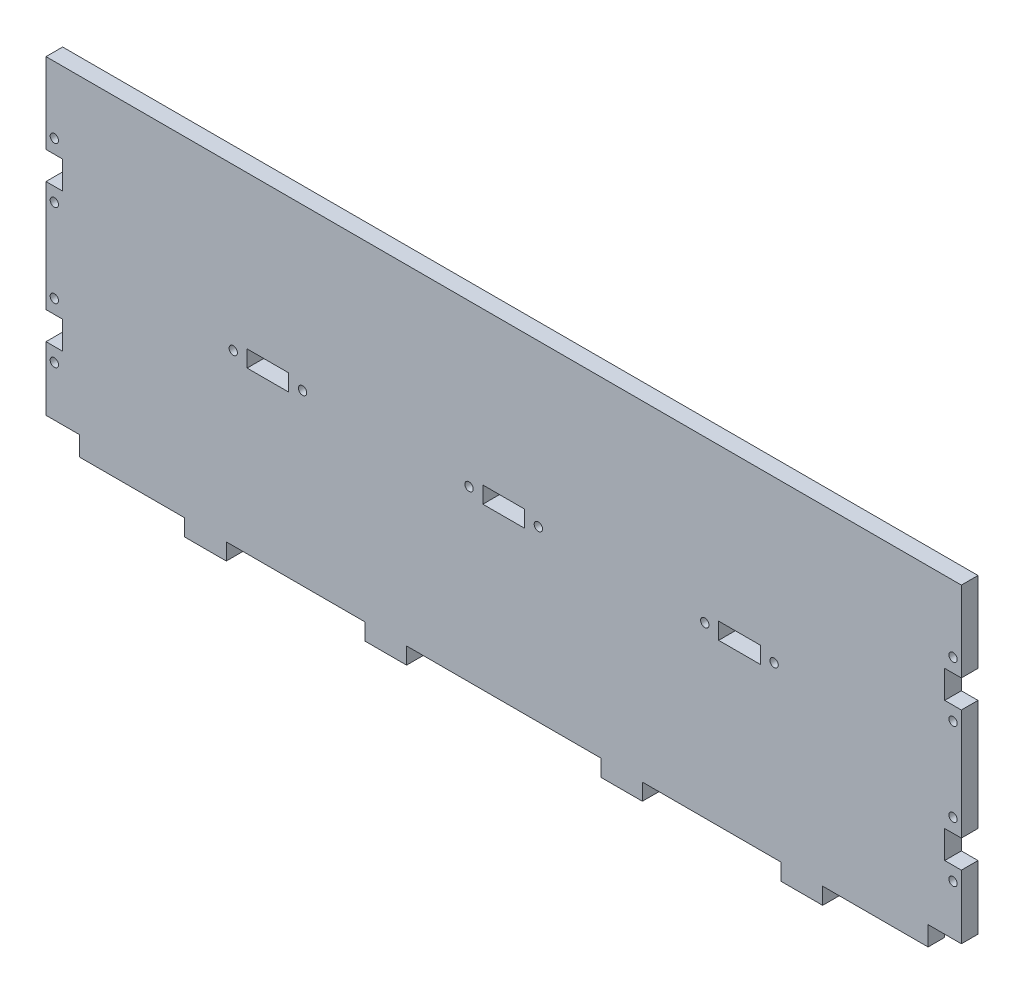
from build123d import *

# Parameters (mm, degrees)
ESQUISSE1_W             = 330
ESQUISSE1_H             = 238
ESQUISSE1_W_2           = 15
ESQUISSE1_H_2           = 6
BOSS_EXTRU_1_DEPTH      = 6
ESQUISSE2_W             = 15
ESQUISSE2_H             = 6
BOSS_EXTRU_2_DEPTH      = 6
ESQUISSE3_W             = 6
ESQUISSE3_H             = 10
ESQUISSE3_W_2           = 12
ESQUISSE3_H_2           = 7
ENL_V_MAT_EXTRU_1_DEPTH = 6
ESQUISSE4_R             = 1.5
ENL_V_MAT_EXTRU_2_DEPTH = 6
ESQUISSE5_W             = 356.185915781
ESQUISSE5_H             = 137.143349898
ENL_V_MAT_EXTRU_3_DEPTH = 6


with BuildPart() as part:
    # Esquisse1 → Boss.-Extru.1 (new body)
    with BuildSketch(Plane.XY):
        Rectangle(ESQUISSE1_W, ESQUISSE1_H)
        with Locations((-85, -58)):
            Rectangle(ESQUISSE1_W_2, ESQUISSE1_H_2, mode=Mode.SUBTRACT)
        with Locations((0, -58)):
            Rectangle(ESQUISSE1_W_2, ESQUISSE1_H_2, mode=Mode.SUBTRACT)
        with Locations((85, -58)):
            Rectangle(ESQUISSE1_W_2, ESQUISSE1_H_2, mode=Mode.SUBTRACT)
    extrude(amount=BOSS_EXTRU_1_DEPTH)

    # Esquisse2 → Boss.-Extru.2 (add)
    with BuildSketch(Plane.XY.offset(6)):
        with Locations((-107.5, 122)):
            Rectangle(ESQUISSE2_W, ESQUISSE2_H)
        with Locations((107.5, 122)):
            Rectangle(ESQUISSE2_W, ESQUISSE2_H)
        with Locations((42.5, 122)):
            Rectangle(ESQUISSE2_W, ESQUISSE2_H)
        with Locations((-42.5, 122)):
            Rectangle(ESQUISSE2_W, ESQUISSE2_H)
        with Locations((107.5, -122)):
            Rectangle(ESQUISSE2_W, ESQUISSE2_H)
        with Locations((-107.5, -122)):
            Rectangle(ESQUISSE2_W, ESQUISSE2_H)
        with Locations((-42.5, -122)):
            Rectangle(ESQUISSE2_W, ESQUISSE2_H)
        with Locations((42.5, -122)):
            Rectangle(ESQUISSE2_W, ESQUISSE2_H)
    extrude(amount=-BOSS_EXTRU_2_DEPTH)

    # Esquisse3 → Enlèv. mat.-Extru.1 (cut)
    with BuildSketch(Plane.XY.offset(6)):
        with Locations((-162, 84)):
            Rectangle(ESQUISSE3_W, ESQUISSE3_H)
        with Locations((-162, 34)):
            Rectangle(ESQUISSE3_W, ESQUISSE3_H)
        with Locations((-162, -34)):
            Rectangle(ESQUISSE3_W, ESQUISSE3_H)
        with Locations((-162, -84)):
            Rectangle(ESQUISSE3_W, ESQUISSE3_H)
        with Locations((162, -84)):
            Rectangle(ESQUISSE3_W, ESQUISSE3_H)
        with Locations((162, -34)):
            Rectangle(ESQUISSE3_W, ESQUISSE3_H)
        with Locations((162, 34)):
            Rectangle(ESQUISSE3_W, ESQUISSE3_H)
        with Locations((162, 84)):
            Rectangle(ESQUISSE3_W, ESQUISSE3_H)
        with Locations((159, -115.5)):
            Rectangle(ESQUISSE3_W_2, ESQUISSE3_H_2)
        with Locations((-159, -115.5)):
            Rectangle(ESQUISSE3_W_2, ESQUISSE3_H_2)
    extrude(amount=-ENL_V_MAT_EXTRU_1_DEPTH, mode=Mode.SUBTRACT)

    # Esquisse4 → Enlèv. mat.-Extru.2 (cut)
    with BuildSketch(Plane.XY.offset(6)):
        with Locations((-162, 114)):
            Circle(ESQUISSE4_R)
        with Locations((-162, 94)):
            Circle(ESQUISSE4_R)
        with Locations((-162, 74)):
            Circle(ESQUISSE4_R)
        with Locations((-162, 44)):
            Circle(ESQUISSE4_R)
        with Locations((-162, 24)):
            Circle(ESQUISSE4_R)
        with Locations((-162, -24)):
            Circle(ESQUISSE4_R)
        with Locations((-162, -44)):
            Circle(ESQUISSE4_R)
        with Locations((-162, -74)):
            Circle(ESQUISSE4_R)
        with Locations((-162, -94)):
            Circle(ESQUISSE4_R)
        with Locations((-97.5, -58)):
            Circle(ESQUISSE4_R)
        with Locations((-72.5, -58)):
            Circle(ESQUISSE4_R)
        with Locations((162, -94)):
            Circle(ESQUISSE4_R)
        with Locations((162, -74)):
            Circle(ESQUISSE4_R)
        with Locations((162, -44)):
            Circle(ESQUISSE4_R)
        with Locations((162, -24)):
            Circle(ESQUISSE4_R)
        with Locations((162, 24)):
            Circle(ESQUISSE4_R)
        with Locations((162, 44)):
            Circle(ESQUISSE4_R)
        with Locations((162, 74)):
            Circle(ESQUISSE4_R)
        with Locations((162, 94)):
            Circle(ESQUISSE4_R)
        with Locations((162, 114)):
            Circle(ESQUISSE4_R)
        with Locations((-12.5, -58)):
            Circle(ESQUISSE4_R)
        with Locations((12.5, -58)):
            Circle(ESQUISSE4_R)
        with Locations((72.5, -58)):
            Circle(ESQUISSE4_R)
        with Locations((97.5, -58)):
            Circle(ESQUISSE4_R)
    extrude(amount=-ENL_V_MAT_EXTRU_2_DEPTH, mode=Mode.SUBTRACT)

    # Esquisse5 → Enlèv. mat.-Extru.3 (cut)
    with BuildSketch(Plane.XY.offset(6)):
        with Locations((3.094759514, 68.571674949)):
            Rectangle(ESQUISSE5_W, ESQUISSE5_H)
    extrude(amount=-ENL_V_MAT_EXTRU_3_DEPTH, mode=Mode.SUBTRACT)


solid = part.part
